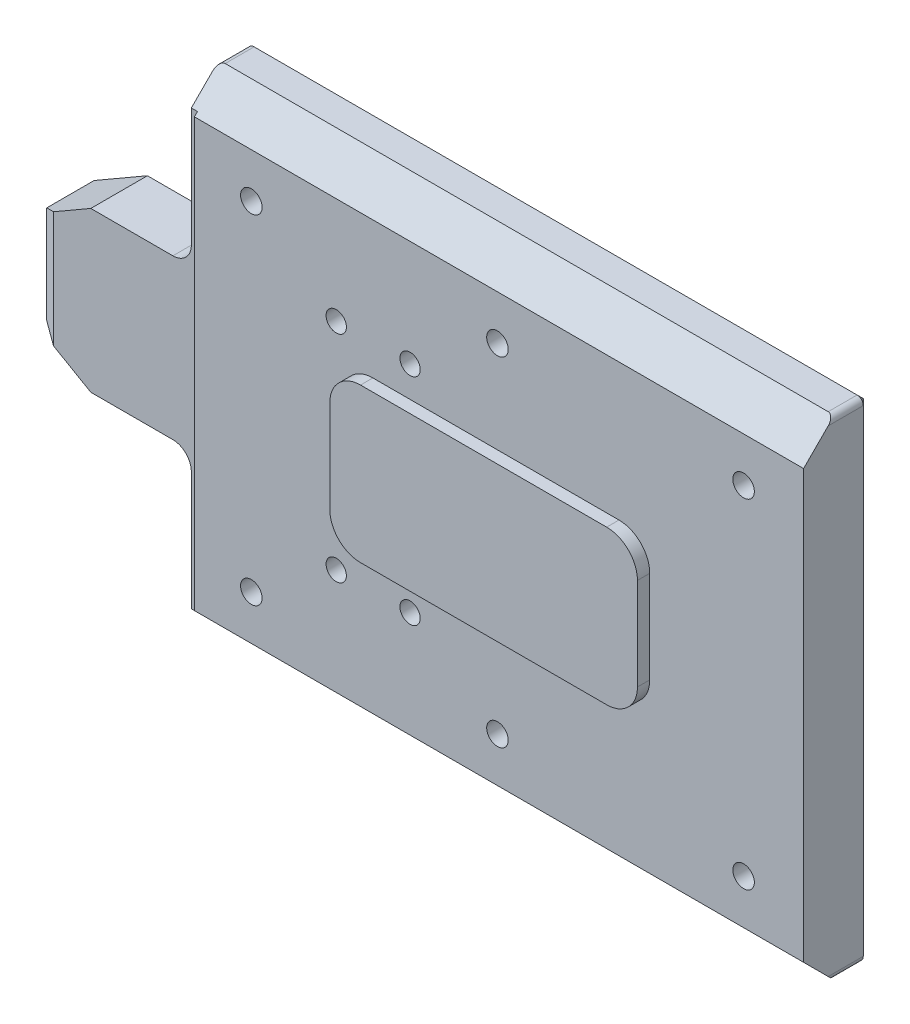
from build123d import *

# Parameters (mm, degrees)
BOSS_EXTRUDE1_DEPTH         = 12.7
CHAMFER1_SIZE               = 5
CHAMFER1_SIZE2              = 8.660254038
TAP_DRILL_FOR_M4X0_7_TAP1_D = 3.3
CUT_EXTRUDE2_START          = -2
CUT_EXTRUDE2_DEPTH          = 2
SKETCH6_W                   = 26
SKETCH6_H                   = 79.5
CUT_EXTRUDE1_DEPTH          = 0.5
FILLET1_R                   = 3
CHAMFER2_SIZE               = 1
CHAMFER3_SIZE               = 1.5
CHAMFER3_SIZE2              = 2.598076211
TAP_DRILL_FOR_M5X0_8_TAP1_D = 3.5
CHAMFER4_SIZE               = 5


# Some blends are built 0.0001 mm under size
with BuildPart() as part:
    # Sketch1 → Boss-Extrude1 (new body)
    with BuildSketch(Plane.XY):
        with BuildLine():
            Line((0, 38.75), (0, 12.9375))
            Line((0, 12.9375), (-25, 12.9375))
            Line((-25, 12.9375), (-25, -12.9375))
            Line((-25, -12.9375), (0, -12.9375))
            Line((0, -12.9375), (0, -38.75))
            ThreePointArc((0, -38.75), (0.292893219, -39.457106781), (1, -39.75))
            Line((1, -39.75), (99, -39.75))
            ThreePointArc((99, -39.75), (99.707106781, -39.457106781), (100, -38.75))
            Line((100, -38.75), (100, 38.75))
            ThreePointArc((100, 38.75), (99.707106781, 39.457106781), (99, 39.75))
            Line((99, 39.75), (1, 39.75))
            ThreePointArc((1, 39.75), (0.292893219, 39.457106781), (0, 38.75))
        make_face()
    extrude(amount=BOSS_EXTRUDE1_DEPTH)

    # Chamfer1
    chamfer1_edges = [part.edges().sort_by_distance(p)[0] for p in [
        (-25, -12.9375, 6.35),
        (-25, 12.9375, 6.35),
    ]]
    chamfer1_side = [part.faces().sort_by_distance(p)[0] for p in [
        (-25, 0, 6.35),
    ]]
    chamfer(chamfer1_edges, length=CHAMFER1_SIZE, length2=CHAMFER1_SIZE2, reference=chamfer1_side[0])

    # Tap Drill for M4x0.7 Tap1 (through all)
    with Locations(Plane(origin=(0, 0, 0), x_dir=(-1, 0, 0), z_dir=(0, 0, -1))):
        with Locations((-24.05, 17.5), (-24.05, -17.5), (-36.05, 17.5), (-36.05, -17.5)):
            Hole(TAP_DRILL_FOR_M4X0_7_TAP1_D / 2)

    # Sketch9 → Cut-Extrude2 (cut)
    with BuildSketch(Plane.XY.offset(12.7).offset(CUT_EXTRUDE2_START)):
        with BuildLine():
            Line((0, 12.9375), (-16.339745962, 12.9375))
            Line((-16.339745962, 12.9375), (-25, 7.9375))
            Line((-25, 7.9375), (-25, -7.9375))
            Line((-25, -7.9375), (-16.339745962, -12.9375))
            Line((-16.339745962, -12.9375), (0, -12.9375))
            Line((0, -12.9375), (0, -38.75))
            ThreePointArc((0, -38.75), (0.292893219, -39.457106781), (1, -39.75))
            Line((1, -39.75), (99, -39.75))
            ThreePointArc((99, -39.75), (99.707106781, -39.457106781), (100, -38.75))
            Line((100, -38.75), (100, 38.75))
            ThreePointArc((100, 38.75), (99.707106781, 39.457106781), (99, 39.75))
            Line((99, 39.75), (1, 39.75))
            ThreePointArc((1, 39.75), (0.292893219, 39.457106781), (0, 38.75))
            Line((0, 38.75), (0, 12.9375))
        make_face()
        with BuildLine():
            Line((70, -12.5), (30, -12.5))
            ThreePointArc((30, -12.5), (26.464466094, -11.035533906), (25, -7.5))
            Line((25, -7.5), (25, 7.5))
            ThreePointArc((25, 7.5), (26.464466094, 11.035533906), (30, 12.5))
            Line((30, 12.5), (70, 12.5))
            ThreePointArc((70, 12.5), (73.535533906, 11.035533906), (75, 7.5))
            Line((75, 7.5), (75, -7.5))
            ThreePointArc((75, -7.5), (73.535533906, -11.035533906), (70, -12.5))
        make_face(mode=Mode.SUBTRACT)
    extrude(amount=CUT_EXTRUDE2_DEPTH, mode=Mode.SUBTRACT)

    # Sketch6 → Cut-Extrude1 (cut)
    with BuildSketch(Plane.XY.offset(10.7)):
        with Locations((-12, 0)):
            Rectangle(SKETCH6_W, SKETCH6_H)
    extrude(amount=-CUT_EXTRUDE1_DEPTH, mode=Mode.SUBTRACT)

    # Fillet1
    fillet1_edges = [part.edges().sort_by_distance(p)[0] for p in [
        (0, 12.9375, 5.1),
        (0, -12.9375, 5.1),
    ]]
    fillet(fillet1_edges, radius=FILLET1_R)

    # Chamfer2
    chamfer2_edges = [part.edges().sort_by_distance(p)[0] for p in [
        (0, 27.34375, 0),
        (0.292893219, 39.457106781, 0),
        (50, 39.75, 0),
        (99.707106781, 39.457106781, 0),
        (100, 0, 0),
        (99.707106781, -39.457106781, 0),
        (50, -39.75, 0),
        (0.292893219, -39.457106781, 0),
        (0, -27.34375, 0),
        (-9.669872981, 12.9375, 0),
        (-0.878679656, -13.816179656, 0),
        (-0.878679656, 13.816179656, 0),
        (-25, 0, 0),
        (-9.669872981, -12.9375, 0),
        (-20.669872981, -10.4375, 0),
        (-20.669872981, 10.4375, 0),
    ]]
    chamfer(chamfer2_edges, length=CHAMFER2_SIZE - 0.0001)  # a hair under: the kernel refuses the full size

    # Chamfer3
    chamfer3_edges = [part.edges().sort_by_distance(p)[0] for p in [
        (-25, 0, 10.2),
    ]]
    chamfer3_side = [part.faces().sort_by_distance(p)[0] for p in [
        (-25, 0, 5.59995),
    ]]
    chamfer(chamfer3_edges, length=CHAMFER3_SIZE, length2=CHAMFER3_SIZE2, reference=chamfer3_side[0])

    # Tap Drill for M5x0.8 Tap1 (through all)
    with Locations(Plane(origin=(0, 0, 0), x_dir=(-1, 0, 0), z_dir=(0, 0, -1))):
        with Locations((-90.25, 27.5), (-50.25, 27.5), (-10.25, 27.5), (-10.25, -27.5), (-50.25, -27.5), (-90.25, -27.5)):
            Hole(TAP_DRILL_FOR_M5X0_8_TAP1_D / 2)

    # Chamfer4
    # the kernel refuses this chamfer: 5 mm, written as the material it takes off along each edge
    with BuildSketch(Plane(origin=(-11.85841494, -39.75, 10.7), x_dir=(0, -0.027495876610586317, -0.9996219169112968), z_dir=(1, 0, 0)), Plane(origin=(111.85841494, 39.75, 10.7), x_dir=(0, 0.027495876610586317, -0.9996219169112968), z_dir=(-1, 0, 0))) as chamfer4_piece_1:
        Polygon((CHAMFER4_SIZE * 0.999621916911, CHAMFER4_SIZE * 0.0274958766106), (-CHAMFER4_SIZE * 0.0274958766106, CHAMFER4_SIZE * 0.999621916911), (0, 0), align=None)
    extrude(amount=123.71682988, mode=Mode.SUBTRACT)


solid = part.part
